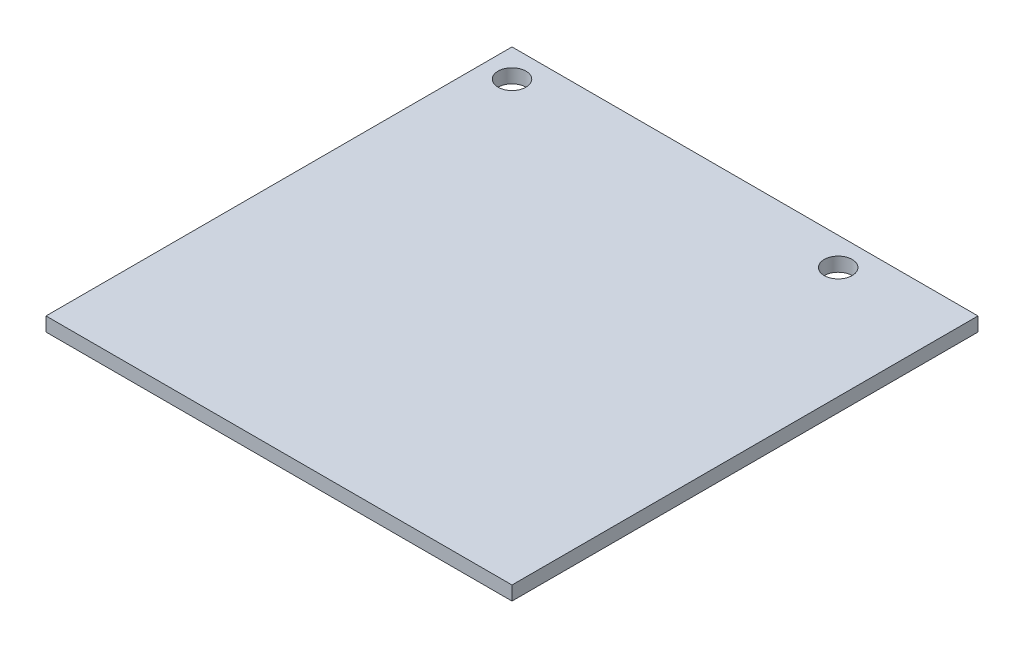
from build123d import *

# Parameters (mm, degrees)
SKETCH1_W           = 50
SKETCH1_H           = 50
SKETCH1_R           = 1.5
BOSS_EXTRUDE1_DEPTH = 1.5


with BuildPart() as part:
    # Sketch1 → Boss-Extrude1 (new body)
    with BuildSketch(Plane(origin=(0, 0, 0), x_dir=(1, 0, 0), z_dir=(0, 1, 0))):
        with Locations((25, 25)):
            Rectangle(SKETCH1_W, SKETCH1_H)
        with Locations((38, 47)):
            Circle(SKETCH1_R, mode=Mode.SUBTRACT)
        with Locations((3, 47)):
            Circle(SKETCH1_R, mode=Mode.SUBTRACT)
    extrude(amount=BOSS_EXTRUDE1_DEPTH)


solid = part.part
